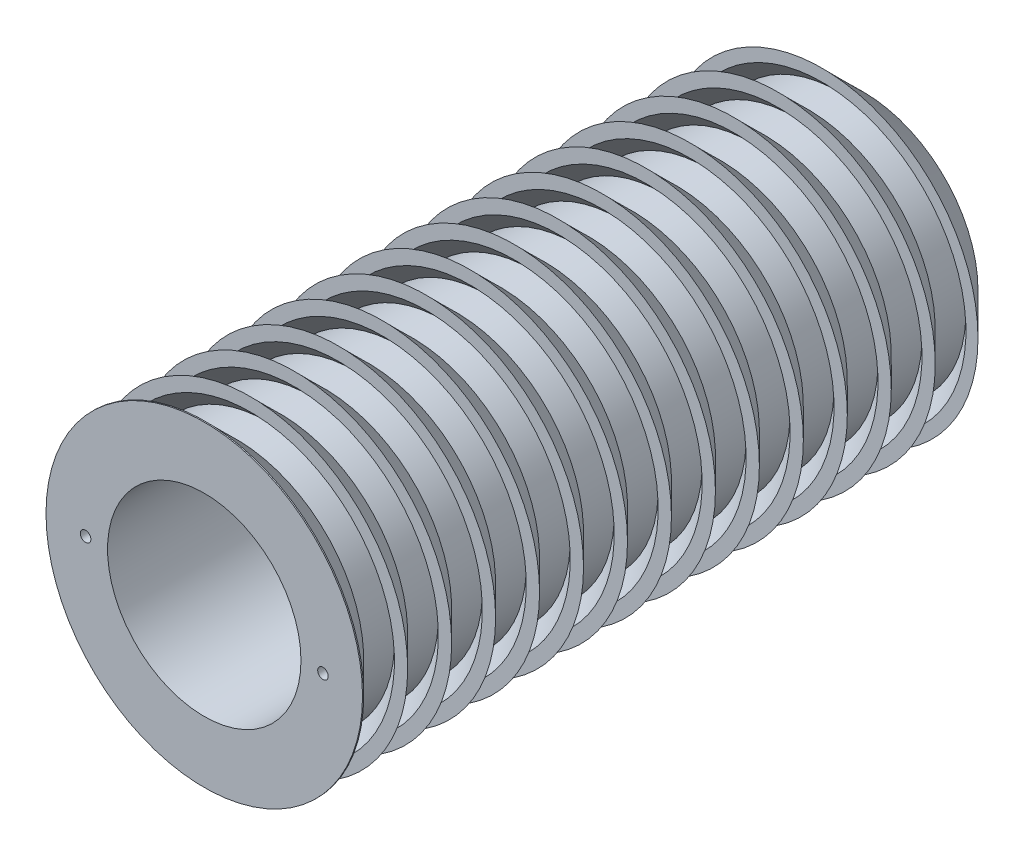
from build123d import *

# Parameters (mm, degrees)
ESBO_O1_R                = 36
RESSALTO_EXTRUS_O1_DEPTH = 150
PADR_O_LINEAR1_COUNT     = 14
PADR_O_LINEAR1_PITCH     = 10
CHANFRO1_SIZE            = 10
ESBO_O4_R                = 22
CORTE_EXTRUS_O1_DEPTH    = 134
ESBO_O5_R                = 1.2
CORTE_EXTRUS_O2_DEPTH    = 134


with BuildPart() as part:
    # Esboço1 → Ressalto-extrusão1 (new body)
    with BuildSketch(Plane.XY):
        Circle(ESBO_O1_R)
    extrude(amount=RESSALTO_EXTRUS_O1_DEPTH)

    # Esboço2 → Corte-Revolução1 (revolve, cut)
    with BuildSketch(Plane(origin=(0, 0, 0), x_dir=(1, 0, 0), z_dir=(0, 1, 0))):
        Polygon((-36, -9.461286074), (-32.715453344, -9.461286074), (-28.965460668, -5.711293398), (-28.965460668, -12.69403838), (-36, -19.728577712), align=None)
    corte_revolu_o1 = revolve(axis=Axis((0, 0, 0), (0, 0, 1)), mode=Mode.SUBTRACT)

    # Padrão linear1: Corte-Revolução1 ×14
    with Locations(*[(0, 0, i * PADR_O_LINEAR1_PITCH) for i in range(1, PADR_O_LINEAR1_COUNT)]):
        add(corte_revolu_o1, mode=Mode.SUBTRACT)

    # Chanfro1
    # the kernel refuses this chamfer: 10 mm, written as the material it takes off along each edge
    with BuildSketch(Plane(origin=(0, 0, 0), x_dir=(1, 0, 0), z_dir=(0, -1, 0))) as chanfro1_piece_1:
        Polygon((36, CHANFRO1_SIZE), (36 - CHANFRO1_SIZE, 0), (36, 0), align=None)
    revolve(axis=Axis((0, 0, 0), (0, 0, 1)), mode=Mode.SUBTRACT)

    # Esboço4 → Corte-extrusão1 (cut)
    with BuildSketch(Plane.XY.offset(150)):
        Circle(ESBO_O4_R)
    extrude(amount=-CORTE_EXTRUS_O1_DEPTH, mode=Mode.SUBTRACT)

    # Esboço5 → Corte-extrusão2 (cut)
    with BuildSketch(Plane.XY.offset(150)):
        with Locations((-27, 0)):
            Circle(ESBO_O5_R)
        with Locations((27, 0)):
            Circle(ESBO_O5_R)
    extrude(amount=-CORTE_EXTRUS_O2_DEPTH, mode=Mode.SUBTRACT)


solid = part.part
